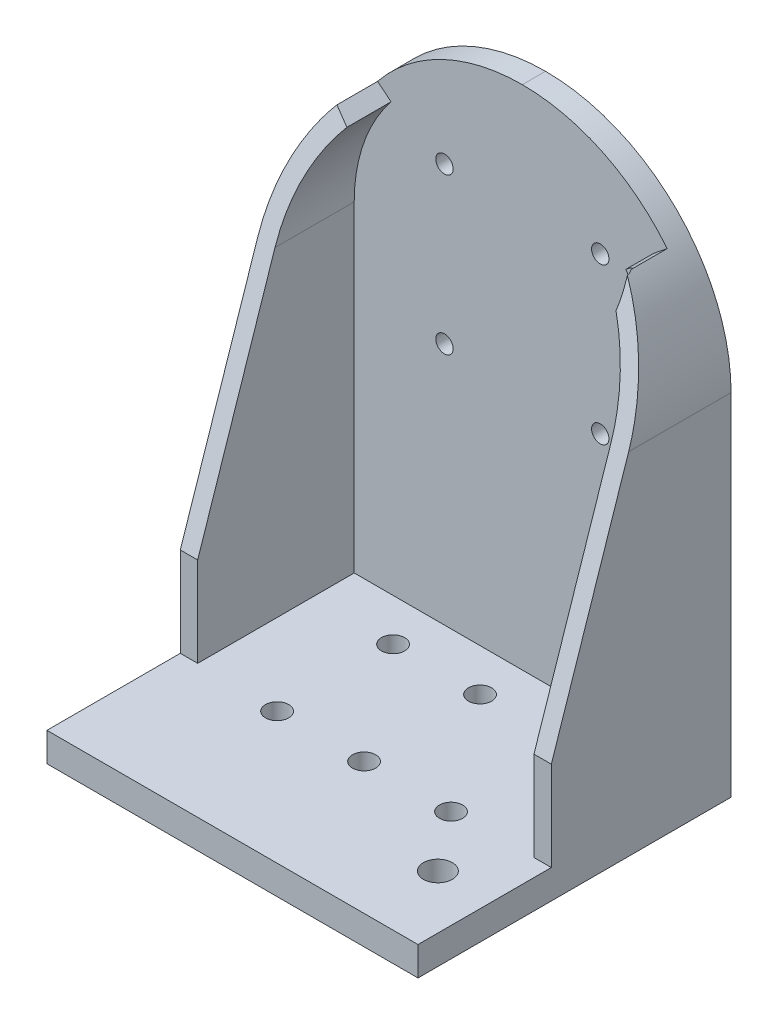
from build123d import *

# Parameters (mm, degrees)
SKETCH_2_W          = 64
SKETCH_2_H          = 50
EXTRUDE_1_DEPTH     = 5
SKETCH_3_W          = 64
SKETCH_3_H          = 92.44
EXTRUDE_2_DEPTH     = 4
SKETCH_5_R          = 1.5
CUT_EXTRUDE_1_DEPTH = 112.736984029
FILLET_1_R          = 32
SKETCH_6_R          = 2
CUT_EXTRUDE_2_DEPTH = 98.52309265
EXTRUDE_1_2_DEPTH   = 27
CUT_EXTRUDE_3_DEPTH = 117.112676311
SKETCH_10_R         = 2.5
CUT_EXTRUDE_4_DEPTH = 103.030160247


with BuildPart() as part:
    # 草图2 → Extrude 1 (new body)
    with BuildSketch(Plane(origin=(0, 0, 0), x_dir=(1, 0, 0), z_dir=(0, 1, 0))):
        Rectangle(SKETCH_2_W, SKETCH_2_H)
    extrude(amount=EXTRUDE_1_DEPTH)

    # 草图3 → 凸台-拉伸2 (add)
    with BuildSketch(Plane(origin=(0, 0, -25), x_dir=(-1, 0, 0), z_dir=(0, 0, -1))):
        with Locations((0, 46.22)):
            Rectangle(SKETCH_3_W, SKETCH_3_H)
    extrude(amount=EXTRUDE_2_DEPTH)

    # 草图5 → 切除-拉伸1 (cut, through all)
    with BuildSketch(Plane(origin=(0, 0, -29), x_dir=(-1, 0, 0), z_dir=(0, 0, -1))):
        with Locations((-13.435028843, 73.875028843)):
            Circle(SKETCH_5_R)
        with Locations((13.435028843, 73.875028843)):
            Circle(SKETCH_5_R)
        with Locations((13.435028843, 47.004971157)):
            Circle(SKETCH_5_R)
        with Locations((-13.435028843, 47.004971157)):
            Circle(SKETCH_5_R)
    extrude(amount=-CUT_EXTRUDE_1_DEPTH, mode=Mode.SUBTRACT)

    # 圆角1
    fillet_1_edges = [part.edges().sort_by_distance(p)[0] for p in [
        (-32, 92.44, -27),
        (32, 92.44, -27),
    ]]
    fillet(fillet_1_edges, radius=FILLET_1_R - 0.0001)  # a hair under: the kernel refuses the full size

    # 草图6 → 切除-拉伸2 (cut, through all)
    with BuildSketch(Plane(origin=(0, 5, 0), x_dir=(1, 0, 0), z_dir=(0, 1, 0))):
        with Locations(Location((-15, 17.7, 0), (0, 0, 270))):
            Circle(SKETCH_6_R)
        with Locations(Location((15, 17.7, 0), (0, 0, 270))):
            Circle(SKETCH_6_R)
        with Locations(Location((0, 17.7, 0), (0, 0, 270))):
            Circle(SKETCH_6_R)
        with Locations(Location((-15, -2.3, 0), (0, 0, 270))):
            Circle(SKETCH_6_R)
        with Locations(Location((0, -2.3, 0), (0, 0, 270))):
            Circle(SKETCH_6_R)
        with Locations(Location((15, -2.3, 0), (0, 0, 270))):
            Circle(SKETCH_6_R)
    extrude(amount=-CUT_EXTRUDE_2_DEPTH, mode=Mode.SUBTRACT)

    # 草图8 → Extrude 1 2 (add)
    with BuildSketch(Plane.XY.offset(-25)):
        with BuildLine():
            ThreePointArc((-24.979991994, 80.44), (-30.194037026, 71.038119083), (-32, 60.44))
            Line((-32, 60.44), (-32, 5))
            Line((-32, 5), (-29, 5))
            Line((-29, 5), (-29, 60.44))
            ThreePointArc((-29, 60.44), (-27.363346054, 70.044545419), (-22.638117744, 78.565))
            Line((-22.638117744, 78.565), (-24.979991994, 80.44))
        make_face()
        with BuildLine():
            Line((32, 5), (32, 60.44))
            ThreePointArc((32, 60.44), (30.194037026, 71.038119083), (24.979991994, 80.44))
            Line((24.979991994, 80.44), (22.638117744, 78.565))
            ThreePointArc((22.638117744, 78.565), (27.363346054, 70.044545419), (29, 60.44))
            Line((29, 60.44), (29, 5))
            Line((29, 5), (32, 5))
        make_face()
    extrude(amount=EXTRUDE_1_2_DEPTH)

    # 草图9 → 切除-拉伸3 (cut, through all)
    with BuildSketch(Plane(origin=(32, 0, 0), x_dir=(0, 0, -1), z_dir=(1, 0, 0))):
        Polygon((18, 80.44), (-2, 20.44), (-2, 80.44), align=None)
    extrude(amount=-CUT_EXTRUDE_3_DEPTH, mode=Mode.SUBTRACT)

    # 草图10 → 切除-拉伸4 (cut, through all)
    with BuildSketch(Plane.XZ):
        with Locations(Location((22.73, -17.7, 0), (0, 0, 270))):
            Circle(SKETCH_10_R)
        with Locations(Location((22.73, 12.3, 0), (0, 0, 270))):
            Circle(SKETCH_10_R)
    extrude(amount=-CUT_EXTRUDE_4_DEPTH, mode=Mode.SUBTRACT)


solid = part.part
